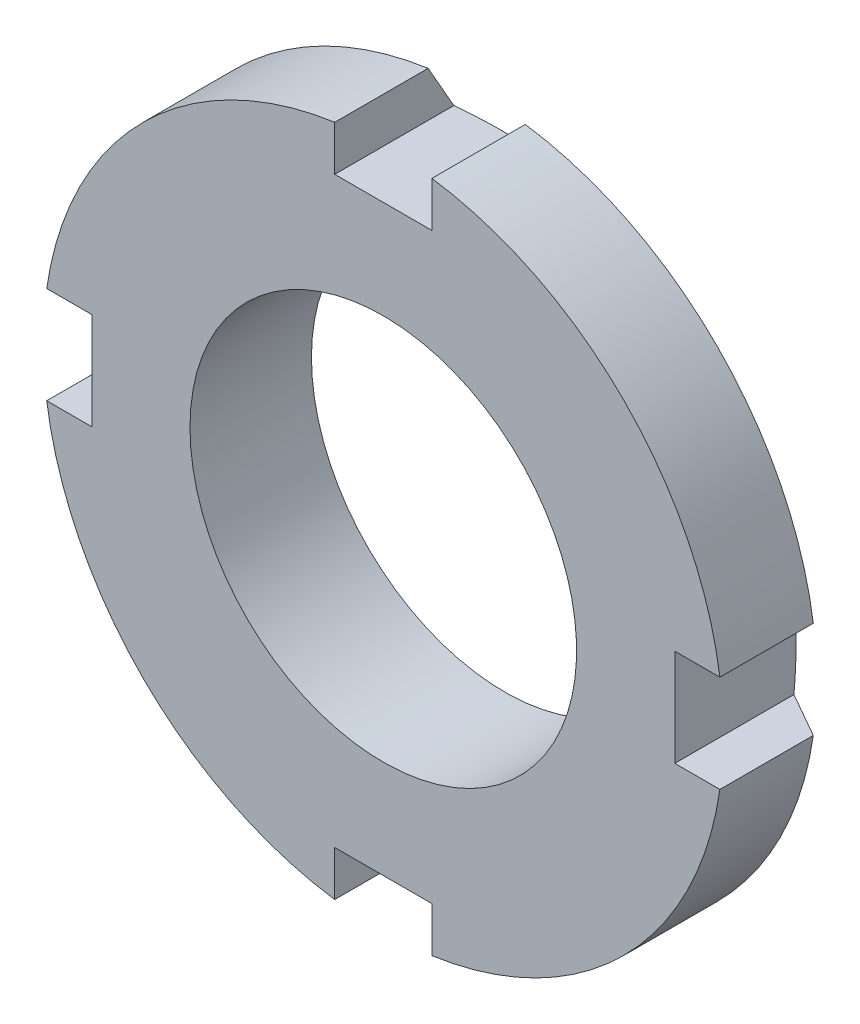
from build123d import *

# Parameters (mm, degrees)
WYTNIJ_WYCI_GNI_CIE1_REACH = 22.421
SZKIC2_R                   = 7.9585
WYTNIJ_WYCI_GNI_CIE2_REACH = 22.421
SZKIC3_W                   = 4
SZKIC3_H                   = 2
SZYK_KO_OWY1_COUNT         = 4


with BuildPart() as part:
    # Szkic1 → Obrót1 (revolve)
    with BuildSketch(Plane(origin=(0, 0, 0), x_dir=(0, 0, -1), z_dir=(1, 0, 0))):
        Polygon((0, 0), (0, 14), (3.845299462, 14), (5, 12), (5, 0), align=None)
    revolve(axis=Axis((0, 0, 0), (0, 0, -1)))

    # Szkic2 → Wytnij-wyciągnięcie1 (cut, up to next)
    with BuildSketch(Plane(origin=(0, 0, -5), x_dir=(-1, 0, 0), z_dir=(0, 0, -1)), mode=Mode.PRIVATE) as wytnij_wyci_gni_cie1_sk1:
        Circle(SZKIC2_R)
    wytnij_wyci_gni_cie1_tool1 = extrude(wytnij_wyci_gni_cie1_sk1.sketch, amount=-WYTNIJ_WYCI_GNI_CIE1_REACH, mode=Mode.PRIVATE) & part.part
    add(wytnij_wyci_gni_cie1_tool1.solids().sort_by_distance((0, 0, -5))[0], mode=Mode.SUBTRACT)

    # Szkic3 → Wytnij-wyciągnięcie2 (cut, up to next)
    with BuildSketch(Plane.XY, mode=Mode.PRIVATE) as wytnij_wyci_gni_cie2_sk1:
        with Locations((0, 13)):
            Rectangle(SZKIC3_W, SZKIC3_H)
    wytnij_wyci_gni_cie2_tool1 = extrude(wytnij_wyci_gni_cie2_sk1.sketch, amount=-WYTNIJ_WYCI_GNI_CIE2_REACH, mode=Mode.PRIVATE) & part.part
    wytnij_wyci_gni_cie2 = wytnij_wyci_gni_cie2_tool1.solids().sort_by_distance((0, 13, 0))[0]
    add(wytnij_wyci_gni_cie2, mode=Mode.SUBTRACT)

    # Szyk kołowy1: Wytnij-wyciągnięcie2 ×4 about axis
    szyk_ko_owy1_axis = Axis((0, 0, 0), (0, 0, 1))
    for i in range(1, SZYK_KO_OWY1_COUNT):
        add(wytnij_wyci_gni_cie2.rotate(szyk_ko_owy1_axis, i * 360 / SZYK_KO_OWY1_COUNT), mode=Mode.SUBTRACT)


solid = part.part
